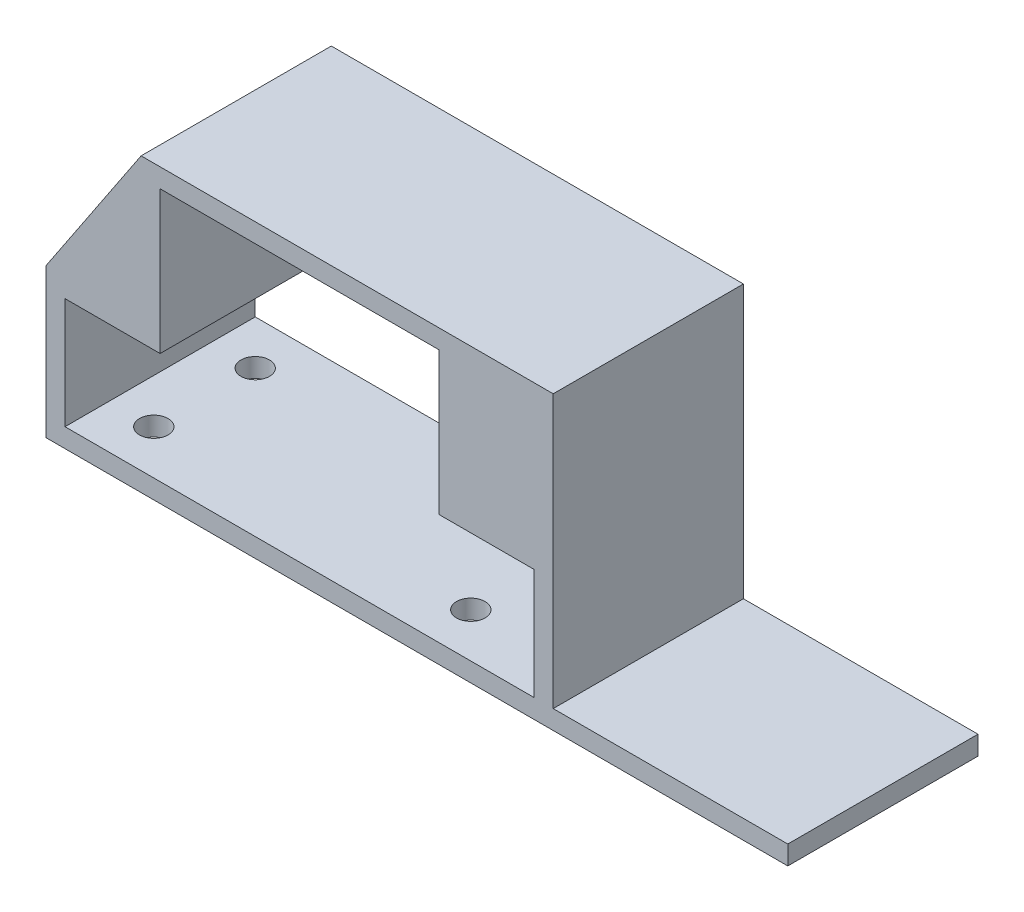
from build123d import *

# Parameters (mm, degrees)
SKETCH1_R           = 2.25
BOSS_EXTRUDE1_DEPTH = 3
BOSS_EXTRUDE2_DEPTH = 30
BOSS_EXTRUDE3_DEPTH = 30


with BuildPart() as part:
    # Sketch1 → Boss-Extrude1 (new body)
    with BuildSketch(Plane(origin=(0, 0, 0), x_dir=(1, 0, 0), z_dir=(0, 1, 0))):
        Polygon((-7, 23), (-7, -7), (57, -7), (107, -7), (107, 23), (57, 23), align=None)
        Circle(SKETCH1_R, mode=Mode.SUBTRACT)
        with Locations((0, 16)):
            Circle(SKETCH1_R, mode=Mode.SUBTRACT)
        with Locations((50, 0)):
            Circle(SKETCH1_R, mode=Mode.SUBTRACT)
        with Locations((50, 16)):
            Circle(SKETCH1_R, mode=Mode.SUBTRACT)
    extrude(amount=BOSS_EXTRUDE1_DEPTH)

    # Sketch2 → Boss-Extrude2 (add)
    with BuildSketch(Plane(origin=(0, 0, -23), x_dir=(-1, 0, 0), z_dir=(0, 0, -1))):
        Polygon((7, 3), (7, 20.5), (-7.999999932, 20.5), (-7.999999932, 43.000000035), (-51.999999932, 43.000000035), (-51.999999932, 20.5), (-66.999999864, 20.5), (-66.999999864, 3), (-69.999999864, 3), (-69.999999864, 46.000000035), (-4.999999932, 46.000000035), (-4.999999932, 23.5), (10, 23.5), (10, 0), (7, 0), align=None)
    extrude(amount=-BOSS_EXTRUDE2_DEPTH)

    # Sketch3 → Boss-Extrude3 (add)
    with BuildSketch(Plane(origin=(0, 0, -23), x_dir=(-1, 0, 0), z_dir=(0, 0, -1))):
        Polygon((-4.999999932, 46.000000035), (10, 23.5), (-4.999999932, 23.5), align=None)
    extrude(amount=-BOSS_EXTRUDE3_DEPTH)


solid = part.part
